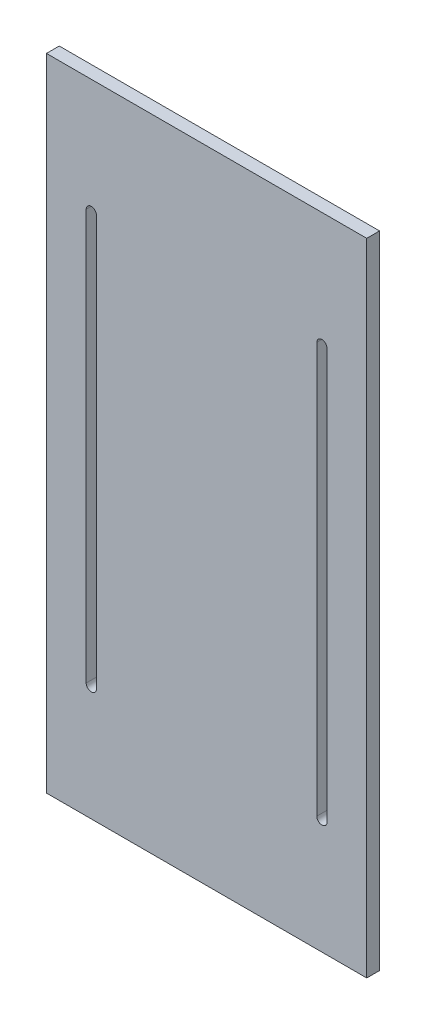
from build123d import *

# Parameters (mm, degrees)
SKETCH1_W            = 50
SKETCH1_H            = 100
BOSS_EXTRUDE1_DEPTH  = 2
CUT_EXTRUDE1_DEPTH   = 56.937465084
LPATTERN1_COUNT      = 2
LPATTERN1_PITCH      = 36
MIRROR1_COPY_1_DEPTH = 56.937465084
MIRROR1_COPY_2_DEPTH = 56.937465084


with BuildPart() as part:
    # Sketch1 → Boss-Extrude1 (new body)
    with BuildSketch(Plane.XY):
        Rectangle(SKETCH1_W, SKETCH1_H)
    extrude(amount=BOSS_EXTRUDE1_DEPTH)

    # Sketch2 → Cut-Extrude1 (cut, through all)
    with BuildSketch(Plane(origin=(0, 0, 0), x_dir=(-1, 0, 0), z_dir=(0, 0, -1))):
        with BuildLine():
            Line((-18.8, 0), (-17.2, 0))
            Line((-17.2, 0), (-17.2, 32.021950636))
            ThreePointArc((-17.2, 32.021950636), (-18, 32.821950636), (-18.8, 32.021950636))
            Line((-18.8, 32.021950636), (-18.8, 0))
        make_face()
    cut_extrude1 = extrude(amount=-CUT_EXTRUDE1_DEPTH, mode=Mode.SUBTRACT)

    # LPattern1: Cut-Extrude1 ×2
    with Locations(*[(-i * LPATTERN1_PITCH, 0, 0) for i in range(1, LPATTERN1_COUNT)]):
        add(cut_extrude1, mode=Mode.SUBTRACT)

    # Mirror1 copy 1 sketch → Mirror1 copy 1 (cut, through all)
    with BuildSketch(Plane(origin=(-36, 0, 0), x_dir=(-1, 0, 0), z_dir=(0, 0, -1))):
        with BuildLine():
            Line((-18.8, 0), (-17.2, 0))
            Line((-17.2, 0), (-17.2, -32.021950636))
            ThreePointArc((-17.2, -32.021950636), (-18, -32.821950636), (-18.8, -32.021950636))
            Line((-18.8, -32.021950636), (-18.8, 0))
        make_face()
    extrude(amount=-MIRROR1_COPY_1_DEPTH, mode=Mode.SUBTRACT)

    # Mirror1 copy 2 sketch → Mirror1 copy 2 (cut, through all)
    with BuildSketch(Plane(origin=(0, 0, 0), x_dir=(-1, 0, 0), z_dir=(0, 0, -1))):
        with BuildLine():
            Line((-18.8, 0), (-17.2, 0))
            Line((-17.2, 0), (-17.2, -32.021950636))
            ThreePointArc((-17.2, -32.021950636), (-18, -32.821950636), (-18.8, -32.021950636))
            Line((-18.8, -32.021950636), (-18.8, 0))
        make_face()
    extrude(amount=-MIRROR1_COPY_2_DEPTH, mode=Mode.SUBTRACT)


solid = part.part
